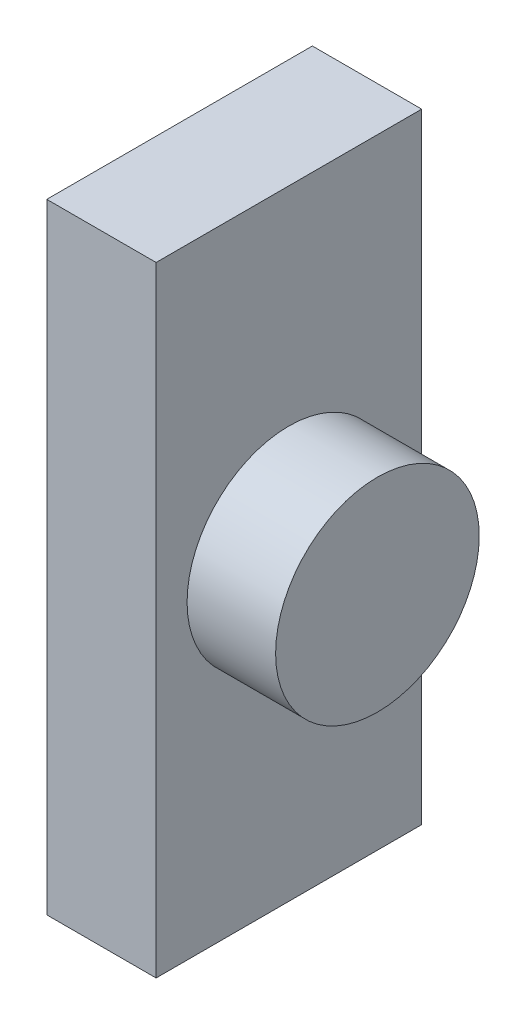
from build123d import *

# Parameters (mm, degrees)
SKETCH1_W           = 15
SKETCH1_H           = 35
SKETCH1_W_2         = 3.375
SKETCH1_H_2         = 17
BOSS_EXTRUDE1_DEPTH = 4.175
SKETCH2_W           = 15
SKETCH2_H           = 35
BOSS_EXTRUDE2_DEPTH = 2
SKETCH3_R           = 5.75
BOSS_EXTRUDE3_DEPTH = 5


with BuildPart() as part:
    # Sketch1 → Boss-Extrude1 (new body)
    with BuildSketch(Plane(origin=(0, 0, 0), x_dir=(0, 0, -1), z_dir=(1, 0, 0))):
        with Locations((7.5, 17.5)):
            Rectangle(SKETCH1_W, SKETCH1_H)
        with Locations((7.5, 17.5)):
            Rectangle(SKETCH1_W_2, SKETCH1_H_2, mode=Mode.SUBTRACT)
    extrude(amount=BOSS_EXTRUDE1_DEPTH)

    # Sketch2 → Boss-Extrude2 (add)
    with BuildSketch(Plane(origin=(4.175, 0, 0), x_dir=(0, 0, -1), z_dir=(1, 0, 0))):
        with Locations((7.5, 17.5)):
            Rectangle(SKETCH2_W, SKETCH2_H)
    extrude(amount=BOSS_EXTRUDE2_DEPTH)

    # Sketch3 → Boss-Extrude3 (add)
    with BuildSketch(Plane(origin=(6.175, 0, 0), x_dir=(0, 0, -1), z_dir=(1, 0, 0))):
        with Locations((7.5, 17.5)):
            Circle(SKETCH3_R)
    extrude(amount=BOSS_EXTRUDE3_DEPTH)


solid = part.part
